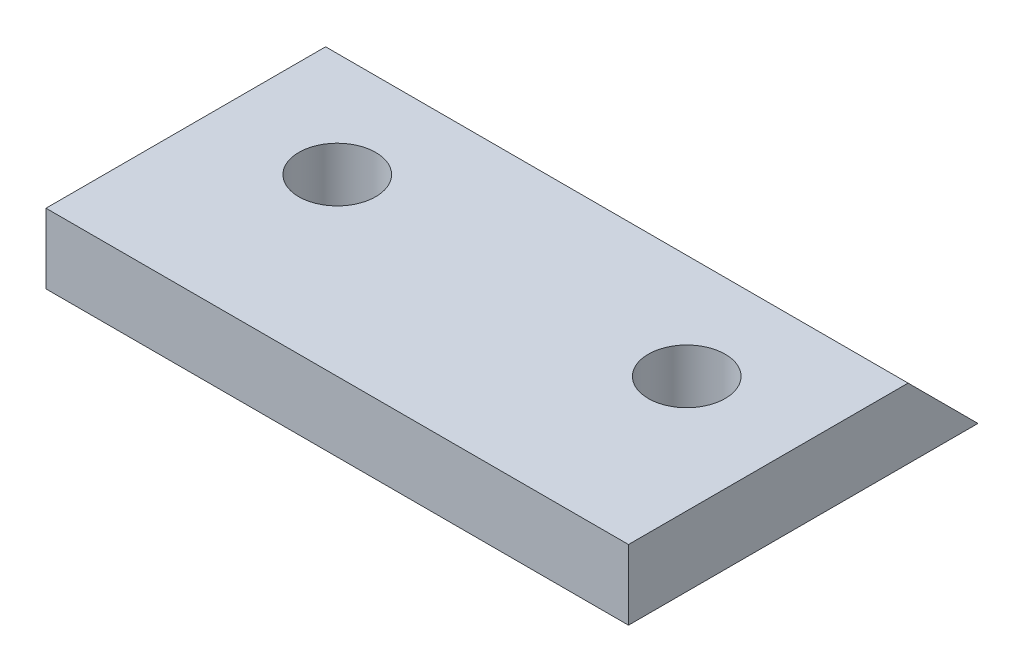
from build123d import *

# Parameters (mm, degrees)
SKETCH1_W             = 25
SKETCH1_H             = 15
BOSS_EXTRUDE1_DEPTH   = 3
M4X0_7_TAPPED_HOLE1_D = 3.3
CHAMFER1_SIZE         = 3


with BuildPart() as part:
    # Sketch1 → Boss-Extrude1 (new body)
    with BuildSketch(Plane(origin=(0, 0, 0), x_dir=(1, 0, 0), z_dir=(0, 1, 0))):
        Rectangle(SKETCH1_W, SKETCH1_H)
    extrude(amount=BOSS_EXTRUDE1_DEPTH)

    # M4x0.7 Tapped Hole1 (through all)
    with Locations(Plane(origin=(0, 3, 0), x_dir=(1, 0, 0), z_dir=(0, 1, 0))):
        with Locations((-7.5, 0), (7.5, 0)):
            Hole(M4X0_7_TAPPED_HOLE1_D / 2)

    # Chamfer1
    chamfer1_edges = [part.edges().sort_by_distance(p)[0] for p in [
        (0, 3, -7.5),
    ]]
    chamfer(chamfer1_edges, length=CHAMFER1_SIZE - 0.0001)  # a hair under: the kernel refuses the full size


solid = part.part
